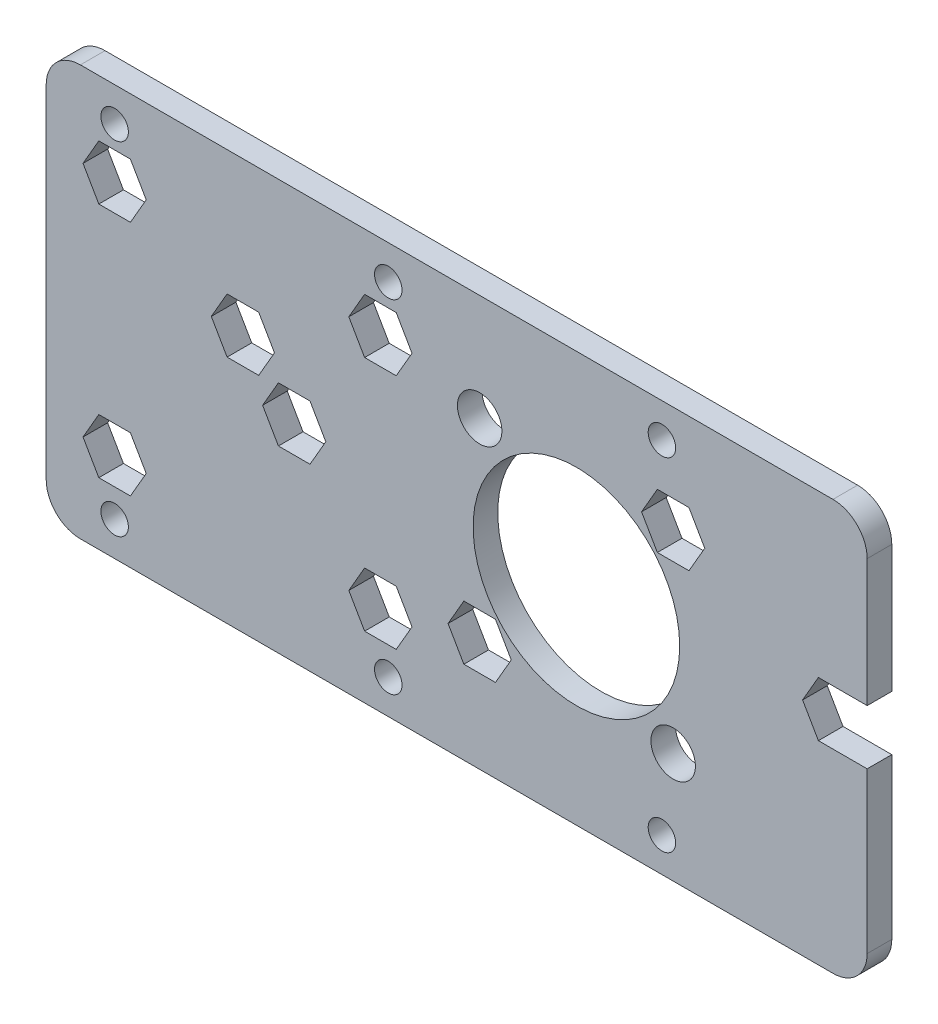
from build123d import *

# Parameters (mm, degrees)
SKETCH1_R           = 2.5527
SKETCH1_R_2         = 4.1275
SKETCH1_R_3         = 19.177
BOSS_EXTRUDE1_DEPTH = 4.572


with BuildPart() as part:
    # Sketch1 → Boss-Extrude1 (new body)
    with BuildSketch(Plane.XY):
        with BuildLine():
            Line((-31.228368207, 68.295406784), (-31.228368207, 4.795406784))
            ThreePointArc((-31.228368207, 4.795406784), (-29.368496268, 0.305278723), (-24.878368207, -1.554593216))
            Line((-24.878368207, -1.554593216), (114.821631793, -1.554593216))
            ThreePointArc((114.821631793, -1.554593216), (119.311759853, 0.305278723), (121.171631793, 4.795406784))
            Line((121.171631793, 4.795406784), (121.171631793, 34.501556975))
            Line((121.171631793, 34.501556975), (117.982923347, 34.501556975))
            Line((117.982923347, 34.501556975), (112.117044612, 34.501556975))
            Line((112.117044612, 34.501556975), (109.184105245, 39.581556975))
            Line((109.184105245, 39.581556975), (112.117044612, 44.661556975))
            Line((112.117044612, 44.661556975), (117.982923347, 44.661556975))
            Line((117.982923347, 44.661556975), (121.171631793, 44.661556975))
            Line((121.171631793, 44.661556975), (121.171631793, 68.295406784))
            ThreePointArc((121.171631793, 68.295406784), (119.311759853, 72.785534845), (114.821631793, 74.645406784))
            Line((114.821631793, 74.645406784), (-24.878368207, 74.645406784))
            ThreePointArc((-24.878368207, 74.645406784), (-29.368496268, 72.785534845), (-31.228368207, 68.295406784))
        make_face()
        with Locations((-18.528368207, 4.795406784)):
            Circle(SKETCH1_R, mode=Mode.SUBTRACT)
        Polygon((-15.59542884, 20.144605974), (-12.662489472, 15.064605974), (-15.59542884, 9.984605974), (-21.461307575, 9.984605974), (-24.394246942, 15.064605974), (-21.461307575, 20.144605974), align=None, mode=Mode.SUBTRACT)
        with Locations((32.271631793, 4.795406784)):
            Circle(SKETCH1_R, mode=Mode.SUBTRACT)
        Polygon((33.744419475, 20.144605974), (36.677358842, 15.064605974), (33.744419475, 9.984605974), (27.87854074, 9.984605974), (24.945601372, 15.064605974), (27.87854074, 20.144605974), align=None, mode=Mode.SUBTRACT)
        with Locations((83.071631793, 4.795406784)):
            Circle(SKETCH1_R, mode=Mode.SUBTRACT)
        Polygon((52.169059029, 24.044091388), (55.101998396, 18.964091388), (52.169059029, 13.884091388), (46.303180294, 13.884091388), (43.370240926, 18.964091388), (46.303180294, 24.044091388), align=None, mode=Mode.SUBTRACT)
        with Locations((85.157144146, 18.964091388)):
            Circle(SKETCH1_R_2, mode=Mode.SUBTRACT)
        Polygon((8.21707116, 51.438326706), (11.150010528, 46.358326706), (8.21707116, 41.278326706), (2.351192425, 41.278326706), (-0.581746942, 46.358326706), (2.351192425, 51.438326706), align=None, mode=Mode.SUBTRACT)
        Polygon((17.74207116, 41.913326706), (20.675010528, 36.833326706), (17.74207116, 31.753326706), (11.876192425, 31.753326706), (8.943253058, 36.833326706), (11.876192425, 41.913326706), align=None, mode=Mode.SUBTRACT)
        Polygon((-15.59542884, 64.138326706), (-12.662489472, 59.058326706), (-15.59542884, 53.978326706), (-21.461307575, 53.978326706), (-24.394246942, 59.058326706), (-21.461307575, 64.138326706), align=None, mode=Mode.SUBTRACT)
        with Locations((-18.528368207, 68.295406784)):
            Circle(SKETCH1_R, mode=Mode.SUBTRACT)
        Polygon((33.744419475, 64.138326706), (36.677358842, 59.058326706), (33.744419475, 53.978326706), (27.87854074, 53.978326706), (24.945601372, 59.058326706), (27.87854074, 64.138326706), align=None, mode=Mode.SUBTRACT)
        with Locations((32.271631793, 68.295406784)):
            Circle(SKETCH1_R, mode=Mode.SUBTRACT)
        with Locations((67.196631903, 36.833326706)):
            Circle(SKETCH1_R_3, mode=Mode.SUBTRACT)
        with Locations((49.236119661, 54.885115872)):
            Circle(SKETCH1_R_2, mode=Mode.SUBTRACT)
        Polygon((88.090083513, 59.965115872), (91.023022881, 54.885115872), (88.090083513, 49.805115872), (82.224204778, 49.805115872), (79.291265411, 54.885115872), (82.224204778, 59.965115872), align=None, mode=Mode.SUBTRACT)
        with Locations((83.071631793, 68.295406784)):
            Circle(SKETCH1_R, mode=Mode.SUBTRACT)
    extrude(amount=BOSS_EXTRUDE1_DEPTH)


solid = part.part
